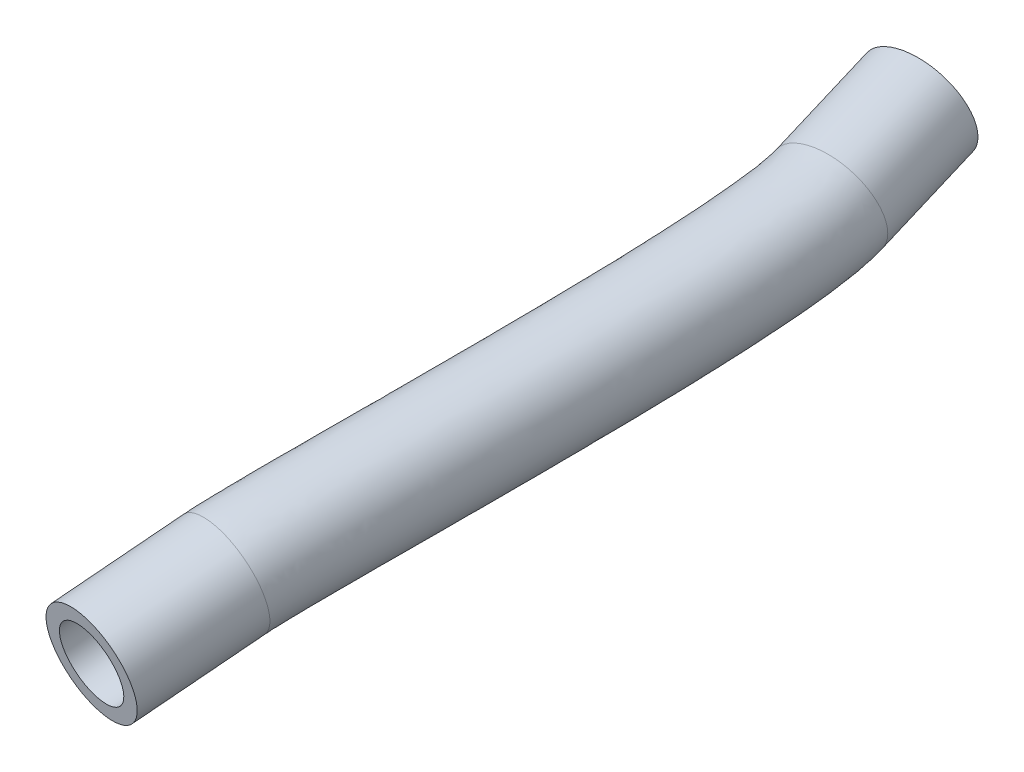
from build123d import *

# Parameters (mm, degrees)
SWEEP1_PROFILE_R     = 13.49375
CUT_SWEEP1_PROFILE_R = 9.525


with BuildPart() as part:
    # Sweep1: sweep along a curve in space
    with BuildLine() as sweep1_path:
        Line((-1498.657831916, -955.558280652, 549.890954335), (-1495.451439442, -962.463971167, 576.835907217))
        add(Edge.make_bspline(
            [(-1495.451439442, -962.463971167, 576.835907217), (-1492.773635015, -968.231227915, 599.338864889), (-1506.213239308, -977.460720688, 705.000322506), (-1508.717993893, -981.674815636, 722.852147445)],
            knots=[0, 0, 0, 0, 1, 1, 1, 1], degree=3))
        Line((-1508.717993893, -981.674815636, 722.852147445), (-1513.013745454, -988.90215242, 753.46872174))
    # Sweep1 profile (on start of the path) → Sweep1 (sweep)
    with BuildSketch(Plane(origin=(-1498.657831916, -955.558280652, 549.890954335), x_dir=(0, 0.9686921588024398, 0.2482649823770341), z_dir=(0.11451401691291656, -0.24663180408701432, 0.9623197457930773))):
        Circle(SWEEP1_PROFILE_R)
    sweep(path=sweep1_path.line)

    # Cut-Sweep1: sweep along a curve in space
    with BuildLine() as cut_sweep1_path:
        Line((-1498.657831916, -955.558280652, 549.890954335), (-1495.451439442, -962.463971167, 576.835907217))
        add(Edge.make_bspline(
            [(-1495.451439442, -962.463971167, 576.835907217), (-1492.773635015, -968.231227915, 599.338864889), (-1506.213239308, -977.460720688, 705.000322506), (-1508.717993893, -981.674815636, 722.852147445)],
            knots=[0, 0, 0, 0, 1, 1, 1, 1], degree=3))
        Line((-1508.717993893, -981.674815636, 722.852147445), (-1513.013745454, -988.90215242, 753.46872174))
    # Cut-Sweep1 profile (on start of the path) → Cut-Sweep1 (sweep, cut)
    with BuildSketch(Plane(origin=(-1498.657831916, -955.558280652, 549.890954335), x_dir=(0, 0.9686921588024398, 0.2482649823770341), z_dir=(0.11451401691291656, -0.24663180408701432, 0.9623197457930773))):
        Circle(CUT_SWEEP1_PROFILE_R)
    sweep(path=cut_sweep1_path.line, mode=Mode.SUBTRACT)


solid = part.part
